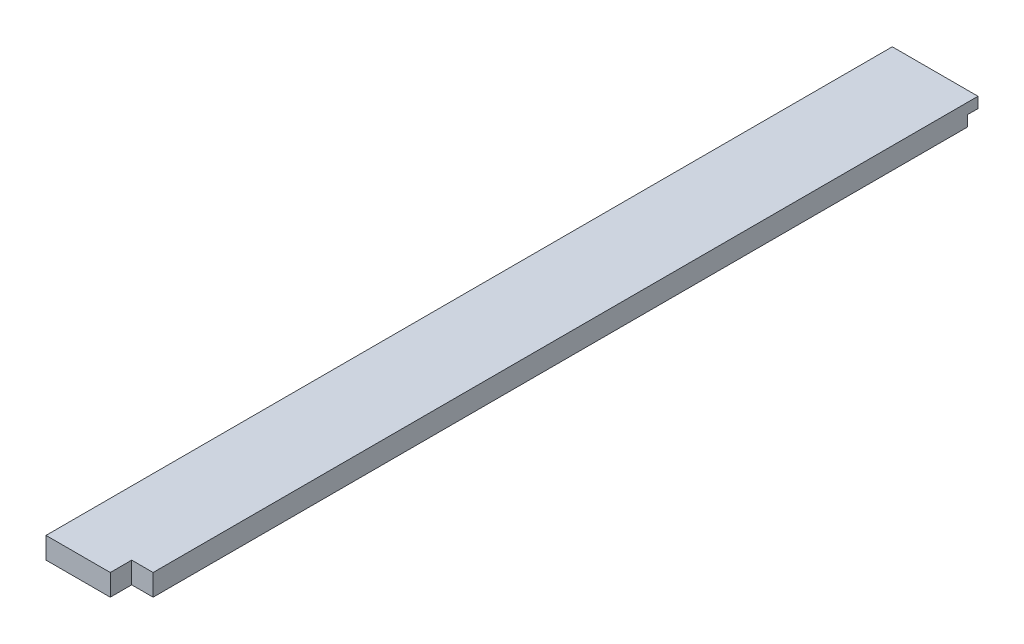
from build123d import *

# Parameters (mm, degrees)
BOSS_EXTRUDE1_DEPTH = 501.65
SKETCH3_W           = 50.8
SKETCH3_H           = 6.35
CUT_EXTRUDE1_DEPTH  = 6.35
SKETCH4_W           = 12.7
SKETCH4_H           = 12.7
CUT_EXTRUDE4_DEPTH  = 505.375507435


with BuildPart() as part:
    # Sketch1 → Boss-Extrude1 (new body)
    with BuildSketch(Plane.XY):
        Polygon((0, 12.7), (38.1, 12.7), (50.8, 12.7), (50.8, 6.35), (50.8, 0), (0, 0), align=None)
    extrude(amount=BOSS_EXTRUDE1_DEPTH)

    # Sketch3 → Cut-Extrude1 (cut)
    with BuildSketch(Plane(origin=(0, 0, 0), x_dir=(1, 0, 0), z_dir=(0, 1, 0))):
        with Locations((25.4, -3.175)):
            Rectangle(SKETCH3_W, SKETCH3_H)
    extrude(amount=CUT_EXTRUDE1_DEPTH, mode=Mode.SUBTRACT)

    # Sketch4 → Cut-Extrude4 (cut, through all)
    with BuildSketch(Plane.XZ):
        with Locations((44.45, 495.3)):
            Rectangle(SKETCH4_W, SKETCH4_H)
    extrude(amount=-CUT_EXTRUDE4_DEPTH, mode=Mode.SUBTRACT)


solid = part.part
